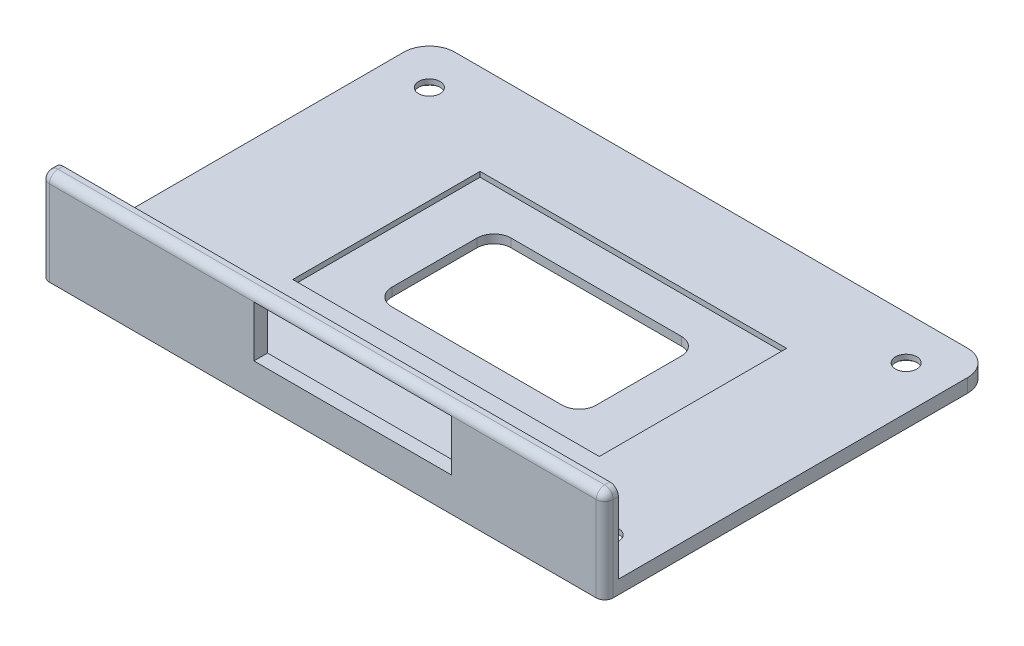
from build123d import *

# Parameters (mm, degrees)
EXTRUDE_1_DEPTH        = 1.6
SKETCH_2_W             = 23.2
SKETCH_2_H             = 6
EXTRUDE_719_DEPTH      = 1.6
CUT_EXTRUDE_1150_REACH = 43.724
SKETCH_5_R             = 2.6
CUT_EXTRUDE_1612_DEPTH = 1
CUT_EXTRUDE_1748_REACH = 43.864
SKETCH_7_R             = 1.25
SKETCH_9_W             = 36
SKETCH_9_H             = 22
CUT_EXTRUDE_2286_DEPTH = 0.6
FILLET_2_R             = 1


with BuildPart() as part:
    # 草图1 → 凸台-拉伸1 (new body)
    with BuildSketch(Plane(origin=(0, 0, 0), x_dir=(1, 0, 0), z_dir=(0, 1, 0))):
        with BuildLine():
            Line((-33.1, -22), (33.1, -22))
            Line((33.1, -22), (33.1, 19))
            ThreePointArc((33.1, 19), (32.221320344, 21.121320344), (30.1, 22))
            Line((30.1, 22), (-30.1, 22))
            ThreePointArc((-30.1, 22), (-32.221320344, 21.121320344), (-33.1, 19))
            Line((-33.1, 19), (-33.1, -22))
        make_face()
    extrude(amount=EXTRUDE_1_DEPTH)

    # 草图2 → Extrude 719 (add)
    with BuildSketch(Plane.XY.offset(22)):
        with BuildLine():
            Line((-33.1, 0), (33.1, 0))
            Line((33.1, 0), (33.1, 10))
            ThreePointArc((33.1, 10), (32.807106781, 10.707106781), (32.1, 11))
            Line((32.1, 11), (17.1, 11))
            Line((17.1, 11), (-9.1, 11))
            Line((-9.1, 11), (-32.1, 11))
            ThreePointArc((-32.1, 11), (-32.807106781, 10.707106781), (-33.1, 10))
            Line((-33.1, 10), (-33.1, 0))
        make_face()
        with Locations((3.5, 7)):
            Rectangle(SKETCH_2_W, SKETCH_2_H, mode=Mode.SUBTRACT)
    extrude(amount=EXTRUDE_719_DEPTH)

    # 草图3 → Cut-Extrude 1150 (cut, up to next)
    with BuildSketch(Plane(origin=(0, 1.6, 0), x_dir=(1, 0, 0), z_dir=(0, 1, 0)), mode=Mode.PRIVATE) as cut_extrude_1150_sk1:
        with BuildLine():
            Line((-8.5, -7), (11.5, -7))
            ThreePointArc((11.5, -7), (12.914213562, -6.414213562), (13.5, -5))
            Line((13.5, -5), (13.5, 5))
            ThreePointArc((13.5, 5), (12.914213562, 6.414213562), (11.5, 7))
            Line((11.5, 7), (-8.5, 7))
            ThreePointArc((-8.5, 7), (-9.914213562, 6.414213562), (-10.5, 5))
            Line((-10.5, 5), (-10.5, -5))
            ThreePointArc((-10.5, -5), (-9.914213562, -6.414213562), (-8.5, -7))
        make_face()
    cut_extrude_1150_tool1 = extrude(cut_extrude_1150_sk1.sketch, amount=-CUT_EXTRUDE_1150_REACH, mode=Mode.PRIVATE) & part.part
    add(cut_extrude_1150_tool1.solids().sort_by_distance((1.5, 1.6, 0))[0], mode=Mode.SUBTRACT)

    # 草图5 → Cut-Extrude 1612 (cut)
    with BuildSketch(Plane.XZ):
        with Locations(Location((-28, -16.9, 0), (0, 0, 270))):
            Circle(SKETCH_5_R)
        with Locations(Location((28, -16.9, 0), (0, 0, 270))):
            Circle(SKETCH_5_R)
        with Locations(Location((28, 18.1, 0), (0, 0, 270))):
            Circle(SKETCH_5_R)
        with Locations(Location((-28, 18.1, 0), (0, 0, 270))):
            Circle(SKETCH_5_R)
    extrude(amount=-CUT_EXTRUDE_1612_DEPTH, mode=Mode.SUBTRACT)

    # 草图7 → Cut-Extrude 1748 (cut, up to next)
    with BuildSketch(Plane.XZ.offset(-1), mode=Mode.PRIVATE) as cut_extrude_1748_sk1:
        with Locations(Location((-28, -16.9, 0), (0, 0, 270))):
            Circle(SKETCH_7_R)
    cut_extrude_1748_tool1 = extrude(cut_extrude_1748_sk1.sketch, amount=-CUT_EXTRUDE_1748_REACH, mode=Mode.PRIVATE) & part.part
    # 草图7 → Cut-Extrude 1748 (cut, up to next)
    with BuildSketch(Plane.XZ.offset(-1), mode=Mode.PRIVATE) as cut_extrude_1748_sk2:
        with Locations(Location((28, -16.9, 0), (0, 0, 270))):
            Circle(SKETCH_7_R)
    cut_extrude_1748_tool2 = extrude(cut_extrude_1748_sk2.sketch, amount=-CUT_EXTRUDE_1748_REACH, mode=Mode.PRIVATE) & part.part
    # 草图7 → Cut-Extrude 1748 (cut, up to next)
    with BuildSketch(Plane.XZ.offset(-1), mode=Mode.PRIVATE) as cut_extrude_1748_sk3:
        with Locations(Location((28, 18.1, 0), (0, 0, 270))):
            Circle(SKETCH_7_R)
    cut_extrude_1748_tool3 = extrude(cut_extrude_1748_sk3.sketch, amount=-CUT_EXTRUDE_1748_REACH, mode=Mode.PRIVATE) & part.part
    # 草图7 → Cut-Extrude 1748 (cut, up to next)
    with BuildSketch(Plane.XZ.offset(-1), mode=Mode.PRIVATE) as cut_extrude_1748_sk4:
        with Locations(Location((-28, 18.1, 0), (0, 0, 270))):
            Circle(SKETCH_7_R)
    cut_extrude_1748_tool4 = extrude(cut_extrude_1748_sk4.sketch, amount=-CUT_EXTRUDE_1748_REACH, mode=Mode.PRIVATE) & part.part
    add(cut_extrude_1748_tool1.solids().sort_by_distance((-28, 1, -16.9))[0], mode=Mode.SUBTRACT)
    add(cut_extrude_1748_tool2.solids().sort_by_distance((28, 1, -16.9))[0], mode=Mode.SUBTRACT)
    add(cut_extrude_1748_tool3.solids().sort_by_distance((28, 1, 18.1))[0], mode=Mode.SUBTRACT)
    add(cut_extrude_1748_tool4.solids().sort_by_distance((-28, 1, 18.1))[0], mode=Mode.SUBTRACT)

    # 草图9 → Cut-Extrude 2286 (cut)
    with BuildSketch(Plane(origin=(0, 1.6, 0), x_dir=(1, 0, 0), z_dir=(0, 1, 0))):
        with Locations((1.500900608, 0.362797629)):
            Rectangle(SKETCH_9_W, SKETCH_9_H)
    extrude(amount=-CUT_EXTRUDE_2286_DEPTH, mode=Mode.SUBTRACT)

    # 圆角2
    fillet_2_edges = [part.edges().sort_by_distance(p)[0] for p in [
        (32.807106781, 10.707106781, 23.6),
        (0, 11, 23.6),
        (-32.807106781, 10.707106781, 23.6),
        (-33.1, 5, 23.6),
        (33.1, 5, 23.6),
    ]]
    fillet(fillet_2_edges, radius=FILLET_2_R - 0.0001)  # a hair under: the kernel refuses the full size


solid = part.part
